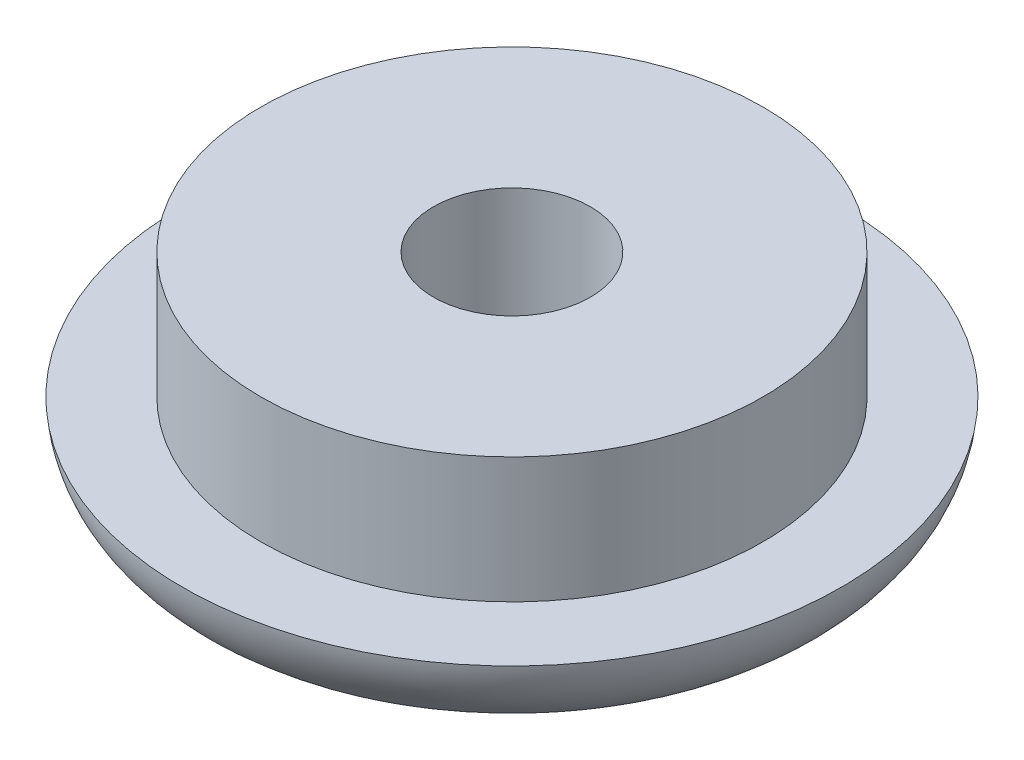
from build123d import *

# Parameters (mm, degrees)
M3X0_5_TAPPED_HOLE1_D     = 2.5
M3X0_5_TAPPED_HOLE1_DEPTH = 4.5
M3X0_5_TAPPED_HOLE1_TIP   = 0.751075774


with BuildPart() as part:
    # Sketch1 → Revolve1 (revolve)
    with BuildSketch(Plane.XY):
        with BuildLine():
            Line((-2.5, 0), (-15, 0))
            ThreePointArc((-15, 0), (-19.069705149, 1.583048928), (-21, 5.5))
            Line((-21, 5.5), (-16, 5.5))
            Line((-16, 5.5), (-16, 13.5))
            Line((-16, 13.5), (-5, 13.5))
            Line((-5, 13.5), (-5, 5.5))
            Line((-5, 5.5), (-2.5, 3))
            Line((-2.5, 3), (-2.5, 0))
        make_face()
    revolve(axis=Axis((0, 0, 0), (0, 1, 0)))

    # M3x0.5 Tapped Hole1
    with Locations(Plane(origin=(0, 0, 0), x_dir=(-1, 0, 0), z_dir=(0, -1, 0))):
        with Locations((12.5, 0), (0, 9.5), (-12.5, 0), (0, -9.5)):
            Hole(M3X0_5_TAPPED_HOLE1_D / 2, depth=M3X0_5_TAPPED_HOLE1_DEPTH)
            with Locations((0, 0, -(M3X0_5_TAPPED_HOLE1_DEPTH + M3X0_5_TAPPED_HOLE1_TIP / 2))):  # 118° drill point
                Cone(0, M3X0_5_TAPPED_HOLE1_D / 2, M3X0_5_TAPPED_HOLE1_TIP, mode=Mode.SUBTRACT)


solid = part.part
